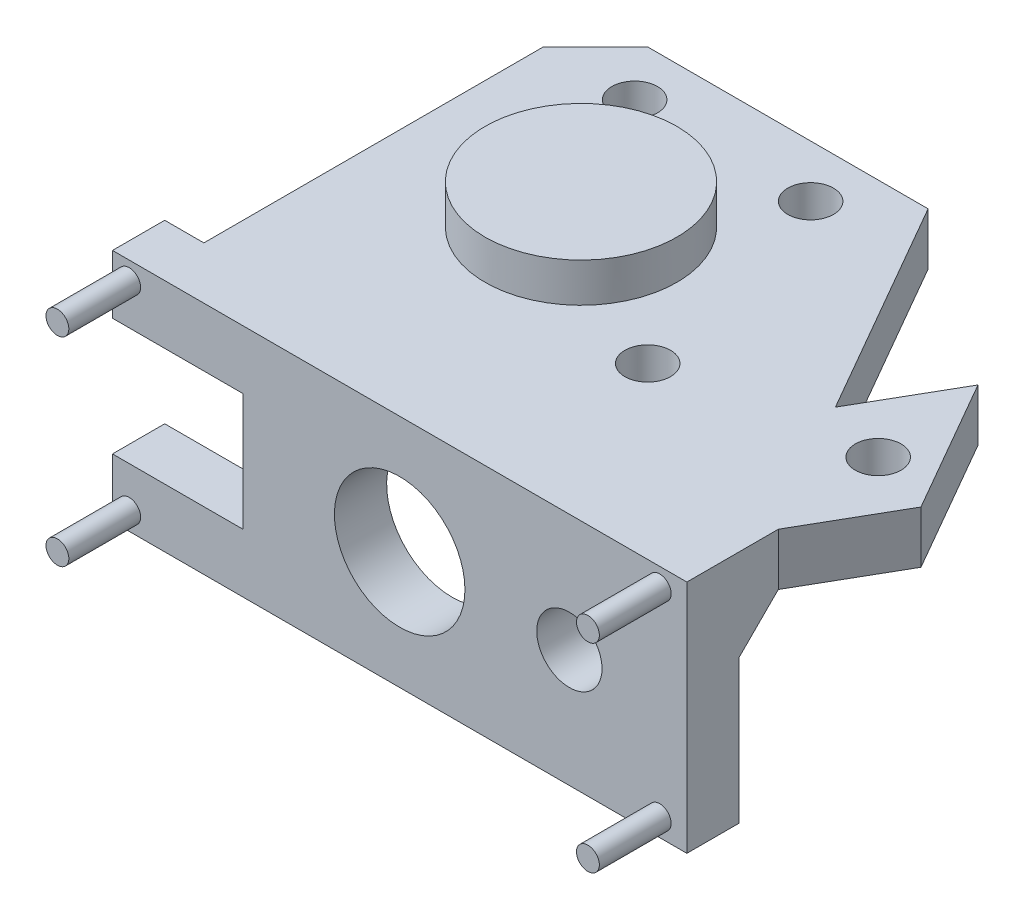
from build123d import *

# Parameters (mm, degrees)
SKETCH_1_W          = 44
SKETCH_1_H          = 18
SKETCH_1_R          = 5
EXTRUDE_1_DEPTH     = 4
SKETCH_2_W          = 10
SKETCH_2_H          = 9
CUT_EXTRUDE_1_DEPTH = 25.103941586
SKETCH_3_R          = 0.875
EXTRUDE_2_DEPTH     = 5.5
SKETCH_4_W          = 41
SKETCH_4_H          = 4
EXTRUDE_3_DEPTH     = 30
SKETCH_5_R          = 7.35
EXTRUDE_4_DEPTH     = 3
CUT_EXTRUDE_2_DEPTH = 40.749213829
EXTRUDE_6_DEPTH     = 4
SKETCH_8_R          = 1.75
CUT_EXTRUDE_3_DEPTH = 43.087666423
CHAMFER_1_SIZE      = 3
SKETCH_9_R          = 2.5
CUT_EXTRUDE_5_DEPTH = 45.445153447
CHAMFER_2_SIZE      = 4


with BuildPart() as part:
    # Эскиз1 → Бобышка-Вытянуть1 (new body)
    with BuildSketch(Plane.XY):
        Rectangle(SKETCH_1_W, SKETCH_1_H)
        Circle(SKETCH_1_R, mode=Mode.SUBTRACT)
    extrude(amount=EXTRUDE_1_DEPTH)

    # Эскиз2 → Вырез-Вытянуть1 (cut, through all)
    with BuildSketch(Plane.XY.offset(4)):
        with Locations((-17, 0)):
            Rectangle(SKETCH_2_W, SKETCH_2_H)
    extrude(amount=-CUT_EXTRUDE_1_DEPTH, mode=Mode.SUBTRACT)

    # Эскиз3 → Бобышка-Вытянуть2 (add)
    with BuildSketch(Plane.XY.offset(4)):
        with Locations((-20.72, 7.62)):
            Circle(SKETCH_3_R)
        with Locations((-20.72, -7.62)):
            Circle(SKETCH_3_R)
        with Locations((19.92, -7.62)):
            Circle(SKETCH_3_R)
        with Locations((19.92, 7.62)):
            Circle(SKETCH_3_R)
    extrude(amount=EXTRUDE_2_DEPTH)

    # Эскиз4 → Бобышка-Вытянуть3 (add)
    with BuildSketch(Plane(origin=(0, 0, 0), x_dir=(-1, 0, 0), z_dir=(0, 0, -1))):
        with Locations((-1.5, 7)):
            Rectangle(SKETCH_4_W, SKETCH_4_H)
    extrude(amount=EXTRUDE_3_DEPTH)

    # Эскиз5 → Бобышка-Вытянуть4 (add)
    with BuildSketch(Plane(origin=(0, 9, 0), x_dir=(1, 0, 0), z_dir=(0, 1, 0))):
        with Locations(Location((-5.61, 15.5, 0), (0, 0, 90))):
            Circle(SKETCH_5_R)
    extrude(amount=EXTRUDE_4_DEPTH)

    # Эскиз6 → Вырез-Вытянуть2 (cut, through all)
    with BuildSketch(Plane.XZ.offset(-5)):
        Polygon((22, -3.01), (6.48, -30), (22, -30), align=None)
    extrude(amount=-CUT_EXTRUDE_2_DEPTH, mode=Mode.SUBTRACT)

    # Эскиз7 → Бобышка-Вытянуть6 (add)
    with BuildSketch(Plane.XZ.offset(-5)):
        Polygon((25.987913824, -9.945167145), (22, -3.01), (16.087917757, -13.291385293), (20.07583158, -20.226552439), align=None)
    extrude(amount=-EXTRUDE_6_DEPTH)

    # Эскиз8 → Вырез-Вытянуть3 (cut, through all)
    with BuildSketch(Plane.XZ.offset(-5)):
        with Locations(Location((21.03791579, -11.618276219, 0), (0, 0, 270))):
            Circle(SKETCH_8_R)
        with Locations(Location((-12, -26, 0), (0, 0, 270))):
            Circle(SKETCH_8_R)
        with Locations(Location((1.48, -26, 0), (0, 0, 270))):
            Circle(SKETCH_8_R)
        with Locations(Location((6, -9, 0), (0, 0, 270))):
            Circle(SKETCH_8_R)
    extrude(amount=-CUT_EXTRUDE_3_DEPTH, mode=Mode.SUBTRACT)

    # Фаска1
    # the kernel refuses this chamfer: 3 mm, written as the material it adds along each edge
    with BuildSketch(Plane(origin=(2.6e-08, 5, 0), x_dir=(0, -0.9996219169112968, 0.027495876610586372), z_dir=(-1, 0, 0))) as chamfer_1_piece_1_section:
        Polygon((CHAMFER_1_SIZE * 0.999621916911, -CHAMFER_1_SIZE * 0.0274958766106), (-CHAMFER_1_SIZE * 0.0274958766106, -CHAMFER_1_SIZE * 0.999621916911), (0, 0), align=None)
    chamfer_1_piece_1 = extrude(amount=26.71504899, mode=Mode.PRIVATE)
    chamfer_1_piece_1 = split(chamfer_1_piece_1, bisect_by=Plane(origin=(-12, 3.70825936, -0.85412968), z_dir=(1, 0, 0)), keep=Keep.TOP, mode=Mode.PRIVATE)
    chamfer_1_piece_1 = chamfer_1_piece_1 - Plane(origin=(0, 0, -0.85412968), x_dir=(1, 0, 0), z_dir=(0, 0, -1)) * Cylinder(5, 66, mode=Mode.PRIVATE)
    add(chamfer_1_piece_1)
    with BuildSketch(Plane(origin=(2.6e-08, 5, 0), x_dir=(0, -0.9996219169112968, 0.027495876610586372), z_dir=(-1, 0, 0))) as chamfer_1_piece_2_section:
        Polygon((CHAMFER_1_SIZE * 0.999621916911, -CHAMFER_1_SIZE * 0.0274958766106), (-CHAMFER_1_SIZE * 0.0274958766106, -CHAMFER_1_SIZE * 0.999621916911), (0, 0), align=None)
    chamfer_1_piece_2 = extrude(amount=19.000000026, mode=Mode.PRIVATE)
    chamfer_1_piece_2 = split(chamfer_1_piece_2, bisect_by=Plane(origin=(-15.5, 4.5, -1.378787879), z_dir=(0, 1, 0)), keep=Keep.TOP, mode=Mode.PRIVATE)
    chamfer_1_piece_2 = split(chamfer_1_piece_2, bisect_by=Plane(origin=(-12, 4.757575758, -1.378787879), z_dir=(-1, 0, 0)), keep=Keep.TOP, mode=Mode.PRIVATE)
    add(chamfer_1_piece_2)
    with BuildSketch(Plane(origin=(22, 5, 0), x_dir=(0, -0.9996219169112968, 0.027495876610586372), z_dir=(-1, 0, 0))) as chamfer_1_piece_3_section:
        Polygon((CHAMFER_1_SIZE * 0.999621916911, -CHAMFER_1_SIZE * 0.0274958766106), (-CHAMFER_1_SIZE * 0.0274958766106, -CHAMFER_1_SIZE * 0.999621916911), (0, 0), align=None)
    chamfer_1_piece_3 = extrude(amount=21.999999974, mode=Mode.PRIVATE)
    chamfer_1_piece_3 = chamfer_1_piece_3 - Plane(origin=(0, 0, -1.018193592), x_dir=(1, 0, 0), z_dir=(0, 0, -1)) * Cylinder(5, 56, mode=Mode.PRIVATE)
    add(chamfer_1_piece_3)

    # Эскиз9 → Вырез-Вытянуть5 (cut, through all)
    with BuildSketch(Plane.XY.offset(4)):
        with Locations((13, 0)):
            Circle(SKETCH_9_R)
    extrude(amount=-CUT_EXTRUDE_5_DEPTH, mode=Mode.SUBTRACT)

    # Фаска2
    chamfer_2_edges = [part.edges().sort_by_distance(p)[0] for p in [
        (-19, 7, -30),
    ]]
    chamfer(chamfer_2_edges, length=CHAMFER_2_SIZE)


solid = part.part
